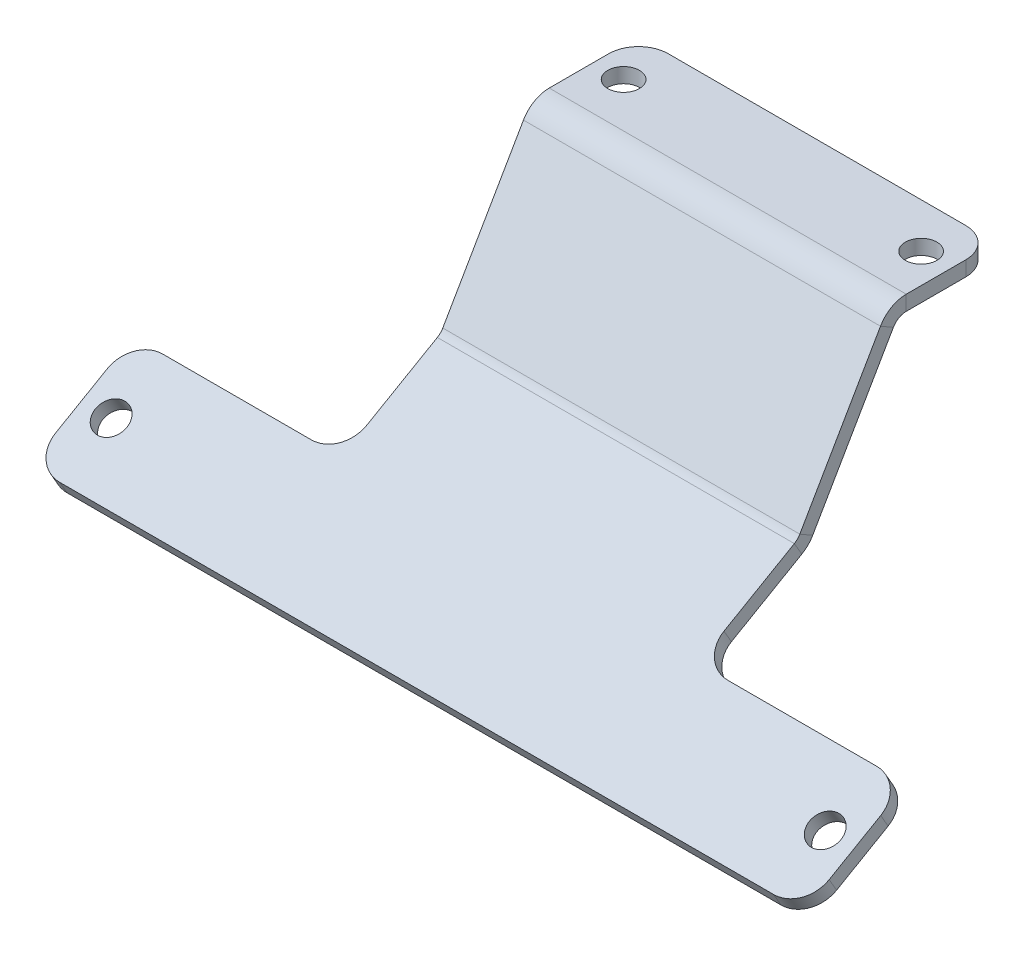
from build123d import *

# Parameters (mm, degrees)
SKETCH1_W               = 76.2
SKETCH1_H               = 19.05
BASE_FLANGE1_DEPTH      = 3.175
EDGE_FLANGE1_DEPTH      = 76.2
EDGE_FLANGE2_DEPTH      = 76.2
F_1_4_CLEARANCE_HOLE1_D = 6.7564
SKETCH17_W              = 165.1
SKETCH17_H              = 25.4
BOSS_EXTRUDE1_DEPTH     = 3.175
F_1_4_CLEARANCE_HOLE3_D = 6.7564
FILLET1_R               = 6.35


# Sheet-metal steps are written as plain solids
with BuildPart() as part:
    # Sketch1 → Base-Flange1 (new body)
    with BuildSketch(Plane(origin=(0, 0, 0), x_dir=(1, 0, 0), z_dir=(0, 1, 0))):
        with Locations((0, -9.525)):
            Rectangle(SKETCH1_W, SKETCH1_H)
    extrude(amount=-BASE_FLANGE1_DEPTH)

    # Edge-Flange1 section (across the edge) → Edge-Flange1 (add)
    with BuildSketch(Plane(origin=(38.1, -3.175, 20.883087105), x_dir=(0, -0.5000000000000041, -0.8660254037844364), z_dir=(-1, 0, 0))):
        with BuildLine():
            Line((-3.175, 1.833087105), (-3.175, 36.266912895))
            Line((-3.175, 36.266912895), (0, 36.266912895))
            Line((0, 36.266912895), (0, 1.833087105))
            ThreePointArc((0, 1.833087105), (0.425369343, 0.245587105), (1.5875, -0.916543552))
            Line((1.5875, -0.916543552), (0, -3.666174209))
            ThreePointArc((0, -3.666174209), (-2.324261314, -1.341912895), (-3.175, 1.833087105))
        make_face()
    extrude(amount=EDGE_FLANGE1_DEPTH)

    # Edge-Flange2 section (across the edge) → Edge-Flange2 (add)
    with BuildSketch(Plane(origin=(-38.1, -33.732329198, 42.191543552), x_dir=(0, 0.866025403784438, 0.5000000000000012), z_dir=(1, 0, 0))):
        with BuildLine():
            Line((-3.175, 0.850738686), (-3.175, 49.949261314))
            Line((-3.175, 49.949261314), (0, 49.949261314))
            Line((0, 49.949261314), (0, 0.850738686))
            ThreePointArc((0, 0.850738686), (0.108185502, 0.028988218), (0.425369343, -0.736761314))
            Line((0.425369343, -0.736761314), (-2.324261314, -2.324261314))
            ThreePointArc((-2.324261314, -2.324261314), (-2.958628997, -0.79276225), (-3.175, 0.850738686))
        make_face()
    extrude(amount=EDGE_FLANGE2_DEPTH)

    # 1/4 Clearance Hole1 (through all)
    with Locations(Plane(origin=(0, 0, 0), x_dir=(1, 0, 0), z_dir=(0, 1, 0))):
        with Locations((-31.75, -9.525), (31.75, -9.525)):
            Hole(F_1_4_CLEARANCE_HOLE1_D / 2)

    # Sketch17 → Boss-Extrude1 (add)
    with BuildSketch(Plane(origin=(0, -7.029772628, -4.058641119), x_dir=(1, 0, 0), z_dir=(0, 0.866025403784438, 0.5000000000000012))):
        with Locations((0, -90.654374454)):
            Rectangle(SKETCH17_W, SKETCH17_H)
    extrude(amount=-BOSS_EXTRUDE1_DEPTH)

    # 1/4 Clearance Hole3 (through all)
    with Locations(Plane(origin=(0, -7.029772628, -4.058641119), x_dir=(1, 0, 0), z_dir=(0, 0.866025403784438, 0.5000000000000012))):
        with Locations((76.2, -90.654374454), (-76.2, -90.654374454)):
            Hole(F_1_4_CLEARANCE_HOLE3_D / 2)

    # Fillet1
    fillet1_edges = [part.edges().sort_by_distance(p)[0] for p in [
        (82.55, -60.081775184, 84.655122751),
        (-82.55, -47.381775184, 62.658077494),
        (82.55, -47.381775184, 62.658077494),
        (-82.55, -60.081775184, 84.655122751),
        (-38.1, -47.381775184, 62.658077494),
        (38.1, -47.381775184, 62.658077494),
        (-38.1, -1.5875, 0),
        (38.1, -1.5875, 0),
    ]]
    fillet(fillet1_edges, radius=FILLET1_R)


solid = part.part
